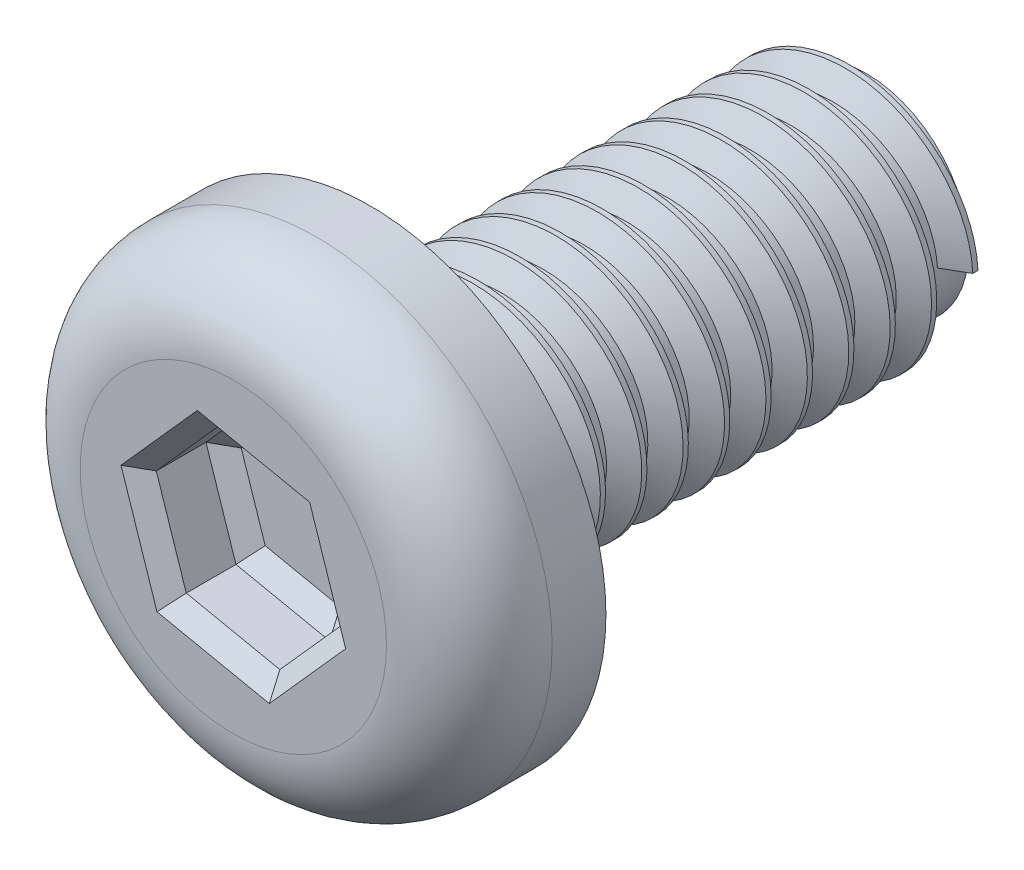
from build123d import *

# Parameters (mm, degrees)
SKETCH_1_R          = 2.85
EXTRUDE_1_DEPTH     = 1.65
SKETCH_2_R          = 1.2295
EXTRUDE_2_DEPTH     = 6
FILLET_1_R          = 1
CUT_EXTRUDE_1_DEPTH = 1
CHAMFER_1_SIZE      = 0.2
THREAD_1_PITCH      = 0.5


with BuildPart() as part:
    # 草图1 → 凸台-拉伸1 (new body)
    with BuildSketch(Plane.XY):
        Circle(SKETCH_1_R)
    extrude(amount=EXTRUDE_1_DEPTH)

    # Sketch 2 → 凸台-拉伸2 (add)
    with BuildSketch(Plane(origin=(0, 0, 0), x_dir=(-1, 0, 0), z_dir=(0, 0, -1))):
        Circle(SKETCH_2_R)
    extrude(amount=EXTRUDE_2_DEPTH)

    # 圆角1
    fillet_1_edges = [part.edges().sort_by_distance(p)[0] for p in [
        (-2.85, 0, 1.65),
    ]]
    fillet(fillet_1_edges, radius=FILLET_1_R)

    # 草图3 → 切除-拉伸1 (cut)
    with BuildSketch(Plane.XY.offset(1.65)):
        Polygon((0.362222341, -1.09641612), (1.130635384, -0.234514311), (0.768413043, 0.861901809), (-0.362222341, 1.09641612), (-1.130635384, 0.234514311), (-0.768413043, -0.861901809), align=None)
    extrude(amount=-CUT_EXTRUDE_1_DEPTH, mode=Mode.SUBTRACT)

    # 倒角1
    chamfer_1_edges = [part.edges().sort_by_distance(p)[0] for p in [
        (-0.203095351, -0.979158965, 0.65),
        (-0.949524213, -0.313693749, 0.65),
        (-0.746428862, 0.665465216, 0.65),
        (0.203095351, 0.979158965, 0.65),
        (0.949524213, 0.313693749, 0.65),
        (0.746428862, -0.665465216, 0.65),
        (-0.203095351, -0.979158965, 1.65),
        (0.746428862, -0.665465216, 1.65),
        (0.949524213, 0.313693749, 1.65),
        (0.203095351, 0.979158965, 1.65),
        (-0.746428862, 0.665465216, 1.65),
        (-0.949524213, -0.313693749, 1.65),
    ]]
    chamfer(chamfer_1_edges, length=CHAMFER_1_SIZE)

    # 螺纹线1: the profile of Sketch 2 2 profile screwed along a right-hand helix of 12 turns, 6 arcs to a turn; built about Z, then put on its axis
    thread_1_z = Axis((0, 0, 0), (0, 0, 1))
    thread_1_corners = [(1.2292, 0, -0.000173205), (1.500132938, 0, 0.156249999), (1.500132938, 0, 0.218749999), (1.2292, 0, 0.375173204)]
    with BuildLine(mode=Mode.PRIVATE) as thread_1_profile:
        Line(thread_1_corners[0], thread_1_corners[1])
        Line(thread_1_corners[1], thread_1_corners[2])
        Line(thread_1_corners[2], thread_1_corners[3])
        Line(thread_1_corners[3], thread_1_corners[0])
    thread_1_cap = Face(thread_1_profile.wire())
    thread_1_turn_angles = [0, 30, 60, 90, 120, 150, 180, 210, 240, 270, 300, 330, 360]
    thread_1_turn_weights = [1, 0.8660254037844387, 1, 0.8660254037844387, 1, 0.8660254037844387, 1, 0.8660254037844387, 1, 0.8660254037844387, 1, 0.8660254037844387, 1]
    thread_1_turn_rails = [Edge.make_bspline([Vector(p[0], p[1], 0).rotate(thread_1_z, thread_1_turn_angles[k]) / thread_1_turn_weights[k] + Vector(0, 0, p[2] + THREAD_1_PITCH * thread_1_turn_angles[k] / 360) for k in range(13)], [0, 0, 0, 1, 1, 2, 2, 3, 3, 4, 4, 5, 5, 6, 6, 6], 2, thread_1_turn_weights) for p in thread_1_corners]
    thread_1_turn_sides = [Face.make_surface_from_curves(thread_1_turn_rails[p[0]], thread_1_turn_rails[p[1]]) for p in [(0, 1), (1, 2), (2, 3), (3, 0)]]
    thread_1 = Plane(origin=(0, 0, -6), x_dir=(1, 0, 0), z_dir=(0, 0, 1)) * Solid(Shell([*[p.moved(Location((0, 0, THREAD_1_PITCH * i))) for i in range(12) for p in thread_1_turn_sides], thread_1_cap, thread_1_cap.rotate(thread_1_z, 4320).moved(Location((0, 0, THREAD_1_PITCH * 4320 / 360)))]))
    add(thread_1)


solid = part.part
